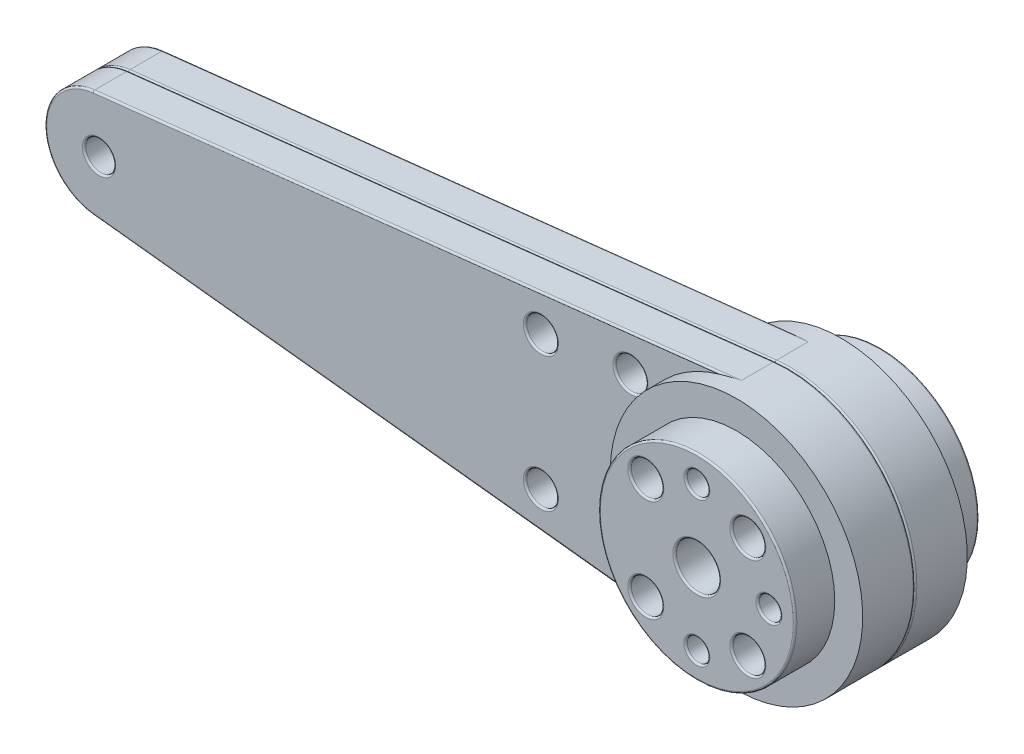
from build123d import *

# Parameters (mm, degrees)
SKETCH_1_R          = 1.7999999999999998
SKETCH_1_R_2        = 1.8000000000000007
SKETCH_1_R_3        = 1.6500000000000021
SKETCH_1_R_4        = 1.7500000000000004
SKETCH_1_R_5        = 1.7499999999999998
SKETCH_1_R_6        = 1.7500000000000009
EXTRUDE_1_DEPTH     = 3.9
EXTRUDE_START       = -6.300000000000001
SKETCH_1_6_R        = 10.9
SKETCH_1_6_R_2      = 1.7999999999999998
SKETCH_1_6_R_3      = 1.8000000000000007
SKETCH_1_6_R_4      = 4
EXTRUDE_2_DEPTH     = 6.300000000000001
EXTRUDE_START_2     = 1.9
SKETCH_3_R          = 10.9
EXTRUDE_3_DEPTH     = 1.9
SKETCH_4_R          = 2.45
CUT_EXTRUDE_2_DEPTH = 81.47625798954623
SKETCH_5_R          = 1.2499999999999998
SKETCH_5_R_2        = 1.2500000000000002
SKETCH_5_R_3        = 1.2499999999999991
CUT_EXTRUDE_3_DEPTH = 81.47625798954623
FILLET_2_R          = 0.2
FILLET_3_R          = 0.2


with BuildPart() as part:
    # 스케치1 → 보스-돌출1 (new body)
    with BuildSketch(Plane.XY):
        with BuildLine():
            Line((-73.25124810579969, 5.96345126102127), (-1.5429122468659604, 13.914719609049653))
            ThreePointArc((-1.5429122468659604, 13.914719609049653), (13.999999999999996, 3.11e-15), (-1.5429122468659573, -13.914719609049653))
            Line((-1.5429122468659573, -13.914719609049653), (-73.25124810579969, -5.963451261021289))
            ThreePointArc((-73.25124810579969, -5.963451261021289), (-78.59, -8.15e-15), (-73.25124810579969, 5.96345126102127))
        make_face()
        with Locations((5.656854249492369, 5.65685424949239)):
            Circle(SKETCH_1_R, mode=Mode.SUBTRACT)
        with Locations((5.65685424949239, -5.656854249492369)):
            Circle(SKETCH_1_R_2, mode=Mode.SUBTRACT)
        with Locations((-5.656854249492368, -5.656854249492391)):
            Circle(SKETCH_1_R, mode=Mode.SUBTRACT)
        with Locations((-5.656854249492391, 5.656854249492368)):
            Circle(SKETCH_1_R, mode=Mode.SUBTRACT)
        with Locations((-72.59, -8.89e-15)):
            Circle(SKETCH_1_R_3, mode=Mode.SUBTRACT)
        with Locations((-23.590000000000003, 7.445547090223239)):
            Circle(SKETCH_1_R_4, mode=Mode.SUBTRACT)
        with Locations((-13.656854249492396, 8.546968653787863)):
            Circle(SKETCH_1_R_5, mode=Mode.SUBTRACT)
        with Locations((-13.656854249492392, -8.546968653787866)):
            Circle(SKETCH_1_R_5, mode=Mode.SUBTRACT)
        with Locations((-23.590000000000003, -7.445547090223244)):
            Circle(SKETCH_1_R_6, mode=Mode.SUBTRACT)
    extrude(amount=EXTRUDE_1_DEPTH)

    # 스케치1<6> → 보스-돌출2 (add)
    # profile 1 of 2: a face of its own
    with BuildSketch(Plane.XY.offset(EXTRUDE_START)):
        Circle(SKETCH_1_6_R)
        with Locations((5.656854249492369, 5.65685424949239)):
            Circle(SKETCH_1_6_R_2, mode=Mode.SUBTRACT)
        with Locations((5.65685424949239, -5.656854249492369)):
            Circle(SKETCH_1_6_R_3, mode=Mode.SUBTRACT)
        with Locations((-5.656854249492368, -5.656854249492391)):
            Circle(SKETCH_1_6_R_2, mode=Mode.SUBTRACT)
        with Locations((-5.656854249492391, 5.656854249492368)):
            Circle(SKETCH_1_6_R_2, mode=Mode.SUBTRACT)
        Circle(SKETCH_1_6_R_4, mode=Mode.SUBTRACT)
    # profile 2 of 2: a face of its own
    with BuildSketch(Plane.XY.offset(EXTRUDE_START)):
        Circle(SKETCH_1_6_R_4)
    extrude(amount=EXTRUDE_2_DEPTH)

    # 스케치3 → 보스-돌출3 (add)
    with BuildSketch(Plane(origin=(0, 0, 0), x_dir=(-1, 0, 0), z_dir=(0, 0, -1)).offset(EXTRUDE_START_2)):
        with BuildLine():
            ThreePointArc((1.542912246865952, -13.914719609049655), (10.43074233830275, -9.33807337045166), (13.999999999999998, -3.43e-15))
            ThreePointArc((13.999999999999998, 0), (10.430742338302759, 9.338073370451651), (1.5429122468659615, 13.914719609049655))
            ThreePointArc((1.5429122468659602, 13.914719609049653), (-14, -2.2e-16), (1.5429122468659566, -13.914719609049659))
        make_face()
        with Locations(Location((0, 0, 0), (0, 0, 180))):
            Circle(SKETCH_3_R, mode=Mode.SUBTRACT)
    extrude(amount=-EXTRUDE_3_DEPTH)

    # 스케치4 → 컷-돌출2 (cut, through all)
    with BuildSketch(Plane(origin=(0, 0, -6.300000000000001), x_dir=(-1, 0, 0), z_dir=(0, 0, -1))):
        Circle(SKETCH_4_R)
    extrude(amount=-CUT_EXTRUDE_2_DEPTH, mode=Mode.SUBTRACT)

    # 스케치5 → 컷-돌출3 (cut, through all)
    with BuildSketch(Plane.XY.offset(3.9)):
        with Locations((7.3e-16, 8)):
            Circle(SKETCH_5_R)
        with Locations((2.69e-15, -8)):
            Circle(SKETCH_5_R_2)
        with Locations((8, 0)):
            Circle(SKETCH_5_R_3)
    extrude(amount=-CUT_EXTRUDE_3_DEPTH, mode=Mode.SUBTRACT)

    # 필렛2
    fillet_2_edges = [part.edges().sort_by_distance(p)[0] for p in [
        (-15.406854249492392, -8.546968653787866, 3.9),
        (-15.406854249492396, 8.546968653787863, 3.9),
        (-25.340000000000003, 7.445547090223239, 3.9),
        (-74.24000000000001, -9.42e-15, 3.9),
        (-37.39708017633283, 9.939085435035462, 3.9),
        (-78.59000000000002, -9.77e-15, 3.9),
        (-10.9, 1.33e-15, -6.300000000000001),
        (-7.456854249492391, 5.656854249492368, -6.300000000000001),
        (-7.456854249492368, -5.656854249492391, -6.300000000000001),
        (-37.39708017633283, -9.939085435035471, 3.9),
        (3.8568542494923896, -5.65685424949237, -6.300000000000001),
        (3.856854249492369, 5.65685424949239, -6.300000000000001),
        (13.999999999999998, 2e-15, 3.9),
        (-25.340000000000003, -7.445547090223244, 3.9),
        (-7.456854249492391, 5.656854249492368, 3.9),
        (-7.456854249492368, -5.656854249492391, 3.9),
        (2.45, 3e-16, 3.9000000000000004),
        (3.8568542494923896, -5.65685424949237, 3.9),
        (2.45, 3e-16, -6.300000000000001),
        (3.856854249492369, 5.65685424949239, 3.9),
        (-1.2499999999999991, 8, -6.300000000000001),
        (-1.2499999999999991, 8, 3.9),
        (6.750000000000001, 1.5e-16, -6.300000000000001),
        (6.750000000000001, 1.5e-16, 3.9),
        (-1.2499999999999976, -8, -6.300000000000001),
        (-1.2499999999999976, -8, 3.9),
    ]]
    fillet(fillet_2_edges, radius=FILLET_2_R)

    # 필렛3
    # the kernel refuses this fillet: 0.2 mm, written as the material it takes off along each edge
    with BuildSketch(Plane(origin=(-23.590000000000003, -7.445547090223244, 0), x_dir=(1, 0, 0), z_dir=(0, -1, 0))) as fillet_3_piece_1:
        with BuildLine():
            CenterArc((1.75 + FILLET_3_R, FILLET_3_R), FILLET_3_R, 180, 90)
            Line((1.75, FILLET_3_R), (1.75, 0))
            Line((1.75, 0), (1.75 + FILLET_3_R, 0))
        make_face()
    revolve(axis=Axis((-23.590000000000003, -7.445547090223244, 0), (0, 0, 1)), mode=Mode.SUBTRACT)
    with BuildSketch(Plane(origin=(-1.0459579751141845, -13.969823617866295, 0), x_dir=(0.11020801763328267, 0.993908543503547, 0), z_dir=(-0.993908543503547, 0.11020801763328267, 0))) as fillet_3_piece_2_section:
        with BuildLine():
            CenterArc((FILLET_3_R, -FILLET_3_R), FILLET_3_R, 90, 90)
            Line((0, -FILLET_3_R), (0, 0))
            Line((0, 0), (FILLET_3_R, 0))
        make_face()
    fillet_3_piece_2 = extrude(amount=72.64782117292246, mode=Mode.PRIVATE)
    fillet_3_piece_2 = fillet_3_piece_2 - Plane(origin=(4.4e-16, 8.9e-16, 0.0449378973195656), x_dir=(-0.11020801763328296, 0.993908543503547, 0), z_dir=(0, 0, -1)) * Cylinder(13.999999999999998, 147, mode=Mode.PRIVATE)
    add(fillet_3_piece_2, mode=Mode.SUBTRACT)
    with BuildSketch(Plane(origin=(-72.59000000000002, -9.55e-15, 0), x_dir=(-0.11020801763327874, -0.9939085435035473, 0), z_dir=(0.9939085435035473, -0.11020801763327874, 0))) as fillet_3_piece_3:
        with BuildLine():
            CenterArc((5.999999999999993 - FILLET_3_R, -FILLET_3_R), FILLET_3_R, 0, 90)
            Line((5.999999999999993 - FILLET_3_R, 3e-17), (5.999999999999993, 0))
            Line((5.999999999999993, 0), (5.999999999999993, -FILLET_3_R))
        make_face()
    revolve(axis=Axis((-72.59000000000002, -9.55e-15, 0), (0, 0, -1)), revolution_arc=167.34538598213177, mode=Mode.SUBTRACT)
    with BuildSketch(Plane(origin=(-73.25124810579969, 5.96345126102127, 0), x_dir=(0, 0, 1), z_dir=(0.9939085435035471, 0.11020801763328296, 0))) as fillet_3_piece_4_section:
        with BuildLine():
            CenterArc((FILLET_3_R, FILLET_3_R), FILLET_3_R, 180, 90)
            Line((-3e-17, FILLET_3_R), (0, 0))
            Line((0, 0), (FILLET_3_R, 0))
        make_face()
    fillet_3_piece_4 = extrude(amount=72.64782117292248, mode=Mode.PRIVATE)
    fillet_3_piece_4 = fillet_3_piece_4 - Plane(origin=(4.4e-16, 8.9e-16, 0.04493768276162775), x_dir=(-0.11020801763328296, 0.993908543503547, 0), z_dir=(0, 0, -1)) * Cylinder(13.999999999999998, 147, mode=Mode.PRIVATE)
    add(fillet_3_piece_4, mode=Mode.SUBTRACT)
    with BuildSketch(Plane(origin=(-72.59, -8.89e-15, 0), x_dir=(1, 0, 0), z_dir=(0, -1, 0))) as fillet_3_piece_5:
        with BuildLine():
            CenterArc((1.6500000000000057 + FILLET_3_R, FILLET_3_R), FILLET_3_R, 180, 90)
            Line((1.6500000000000057, FILLET_3_R), (1.6500000000000057, 0))
            Line((1.6500000000000057, 0), (1.6500000000000057 + FILLET_3_R, 0))
        make_face()
    revolve(axis=Axis((-72.59, -8.89e-15, 0), (0, 0, 1)), mode=Mode.SUBTRACT)
    with BuildSketch(Plane(origin=(-23.590000000000003, 7.445547090223239, 0), x_dir=(1, 0, 0), z_dir=(0, -1, 0))) as fillet_3_piece_6:
        with BuildLine():
            CenterArc((1.75 + FILLET_3_R, FILLET_3_R), FILLET_3_R, 180, 90)
            Line((1.75, FILLET_3_R), (1.75, 0))
            Line((1.75, 0), (1.75 + FILLET_3_R, 0))
        make_face()
    revolve(axis=Axis((-23.590000000000003, 7.445547090223239, 0), (0, 0, 1)), mode=Mode.SUBTRACT)
    with BuildSketch(Plane(origin=(-13.656854249492396, 8.546968653787863, 0), x_dir=(1, 0, 0), z_dir=(0, -1, 0))) as fillet_3_piece_7:
        with BuildLine():
            CenterArc((1.75 + FILLET_3_R, FILLET_3_R), FILLET_3_R, 180, 90)
            Line((1.7499999999999982, FILLET_3_R), (1.75, 0))
            Line((1.75, 0), (1.75 + FILLET_3_R, 0))
        make_face()
    revolve(axis=Axis((-13.656854249492396, 8.546968653787863, 0), (0, 0, 1)), mode=Mode.SUBTRACT)
    with BuildSketch(Plane(origin=(-13.656854249492392, -8.546968653787866, 0), x_dir=(1, 0, 0), z_dir=(0, -1, 0))) as fillet_3_piece_8:
        with BuildLine():
            CenterArc((1.75 + FILLET_3_R, FILLET_3_R), FILLET_3_R, 180, 90)
            Line((1.7500000000000018, FILLET_3_R), (1.75, 0))
            Line((1.75, 0), (1.75 + FILLET_3_R, 0))
        make_face()
    revolve(axis=Axis((-13.656854249492392, -8.546968653787866, 0), (0, 0, 1)), mode=Mode.SUBTRACT)


with BuildPart() as body_2:
    # 대칭 복사1: mirrored copy
    add(part.part.mirror(Plane.XY.offset(3.9)))


solid = Compound([part.part, body_2.part])
